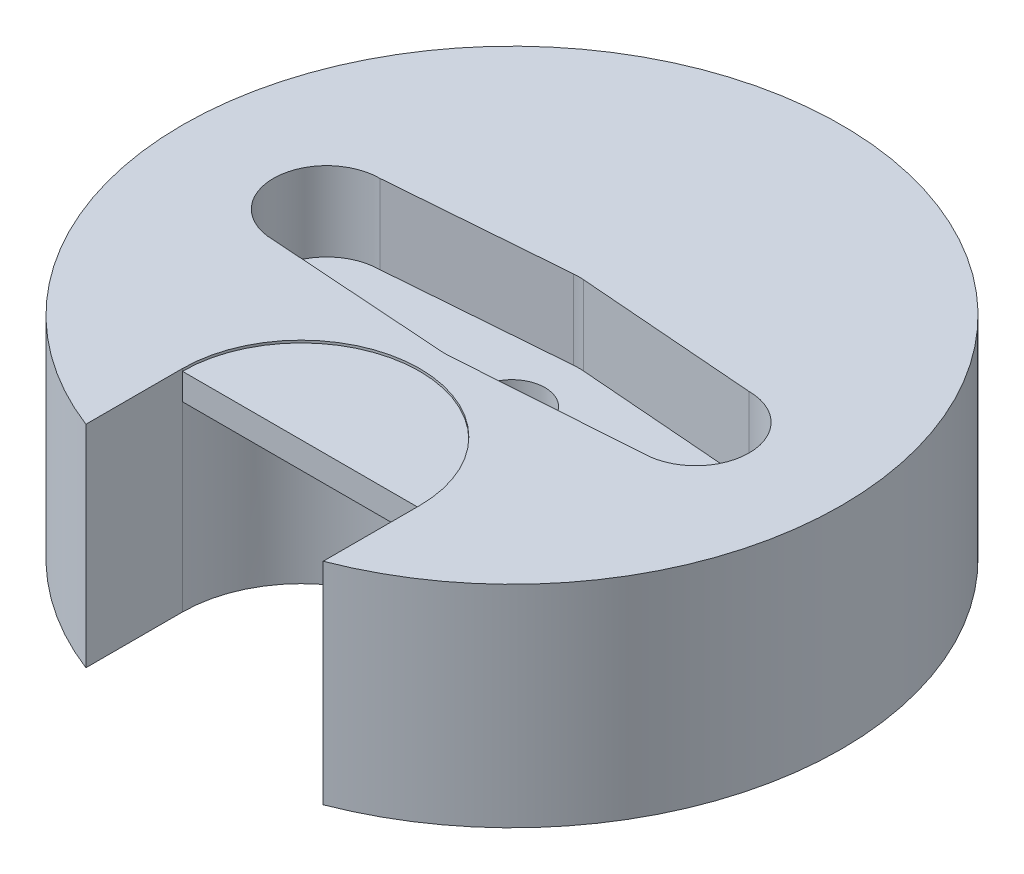
from build123d import *

# Parameters (mm, degrees)
Y_KSEKLIK_EKSTR_ZYON1_DEPTH = 5
IZIM2_R                     = 2.5
KES_EKSTR_ZYON3_DEPTH       = 2.5
IZIM3_R                     = 1.25
KES_EKSTR_ZYON4_DEPTH       = 18.853571071
IZIM5_R                     = 0.6
KES_EKSTR_ZYON5_DEPTH       = 2.5
Y_KSEKLIK_EKSTR_ZYON3_DEPTH = 3
BOSS_EXTRUDE1_START         = 6
BOSS_EXTRUDE1_DEPTH         = 6
CHAMFER1_SIZE               = 5


with BuildPart() as part:
    # Çizim1 → Yükseklik-Ekstrüzyon1 (new body)
    with BuildSketch(Plane(origin=(0, 0, 0), x_dir=(1, 0, 0), z_dir=(0, 1, 0))):
        with BuildLine():
            Line((-4.5, -8), (-4.5, -11.66190379))
            ThreePointArc((-4.5, -11.66190379), (0, 12.5), (4.5, -11.66190379))
            Line((4.5, -11.66190379), (4.5, -8))
            ThreePointArc((4.5, -8), (0, -3.5), (-4.5, -8))
        make_face()
    extrude(amount=Y_KSEKLIK_EKSTR_ZYON1_DEPTH)

    # Çizim2 → Kes-Ekstrüzyon3 (cut)
    with BuildSketch(Plane(origin=(0, 0, 0), x_dir=(1, 0, 0), z_dir=(0, 1, 0))):
        with Locations(Location((0, 0, 0), (0, 0, 270))):
            Circle(IZIM2_R)
    extrude(amount=KES_EKSTR_ZYON3_DEPTH, mode=Mode.SUBTRACT)

    # Çizim3 → Kes-Ekstrüzyon4 (cut, through all)
    with BuildSketch(Plane.XZ.offset(-2.5)):
        with Locations(Location((0, 0, 0), (0, 0, 270))):
            Circle(IZIM3_R)
    extrude(amount=-KES_EKSTR_ZYON4_DEPTH, mode=Mode.SUBTRACT)

    # Çizim5 → Kes-Ekstrüzyon5 (cut)
    with BuildSketch(Plane(origin=(0, 5, 0), x_dir=(1, 0, 0), z_dir=(0, 1, 0))):
        with Locations(Location((-6.449994102, -0.008722575, 0), (0, 0, 270))):
            Circle(IZIM5_R)
        with Locations(Location((6.449994102, 0.008722575, 0), (0, 0, 270))):
            Circle(IZIM5_R)
    extrude(amount=-KES_EKSTR_ZYON5_DEPTH, mode=Mode.SUBTRACT)

    # Çizim6 → Yükseklik-Ekstrüzyon3 (add)
    with BuildSketch(Plane(origin=(0, 5, 0), x_dir=(1, 0, 0), z_dir=(0, 1, 0))):
        with BuildLine():
            Line((-4.5, -11.66190379), (-4.5, -8))
            ThreePointArc((-4.5, -8), (0, -3.5), (4.5, -8))
            Line((4.5, -8), (4.5, -11.66190379))
            ThreePointArc((4.5, -11.66190379), (0, 12.5), (-4.5, -11.66190379))
        make_face()
        with BuildLine():
            Line((7, 1.991277425), (0.197348928, 2.523314182))
            ThreePointArc((0.197348928, 2.523314182), (0, 2.531019767), (-0.197348928, 2.523314182))
            Line((-0.197348928, 2.523314182), (-7, 1.991277425))
            ThreePointArc((-7, 1.991277425), (-9.021556758, -0.030279333), (-7, -2.051836091))
            Line((-7, -2.051836091), (-0.175036702, -2.524960042))
            ThreePointArc((-0.175036702, -2.524960042), (0, -2.531019767), (0.175036702, -2.524960042))
            Line((0.175036702, -2.524960042), (7, -2.051836091))
            ThreePointArc((7, -2.051836091), (9.021556758, -0.030279333), (7, 1.991277425))
        make_face(mode=Mode.SUBTRACT)
    extrude(amount=Y_KSEKLIK_EKSTR_ZYON3_DEPTH)

    # Sketch1 → Boss-Extrude1 (add)
    with BuildSketch(Plane.XZ.offset(-7.908623835).offset(BOSS_EXTRUDE1_START)):
        with BuildLine():
            Line((-4.5, 8), (4.5, 8))
            ThreePointArc((4.5, 8), (0, 3.5), (-4.5, 8))
        make_face()
    extrude(amount=-BOSS_EXTRUDE1_DEPTH)

    # Chamfer1
    # the kernel refuses this chamfer: 5 mm, written as the material it takes off along each edge
    with BuildSketch(Plane(origin=(-17.35841494, 1.908623835, 8), x_dir=(0, -0.027495876610586226, -0.9996219169112968), z_dir=(1, 0, 0))) as chamfer1_piece_1_section:
        Polygon((CHAMFER1_SIZE * 0.999621916911, CHAMFER1_SIZE * 0.0274958766106), (-CHAMFER1_SIZE * 0.0274958766106, CHAMFER1_SIZE * 0.999621916911), (0, 0), align=None)
    chamfer1_piece_1 = extrude(amount=34.71682988, mode=Mode.PRIVATE)
    chamfer1_piece_1 = chamfer1_piece_1 & Plane(origin=(0, 3.682638029, 8), x_dir=(1, 0, 0), z_dir=(0, -1, 0)) * Cylinder(4.5, 90, mode=Mode.PRIVATE)
    add(chamfer1_piece_1, mode=Mode.SUBTRACT)


solid = part.part
